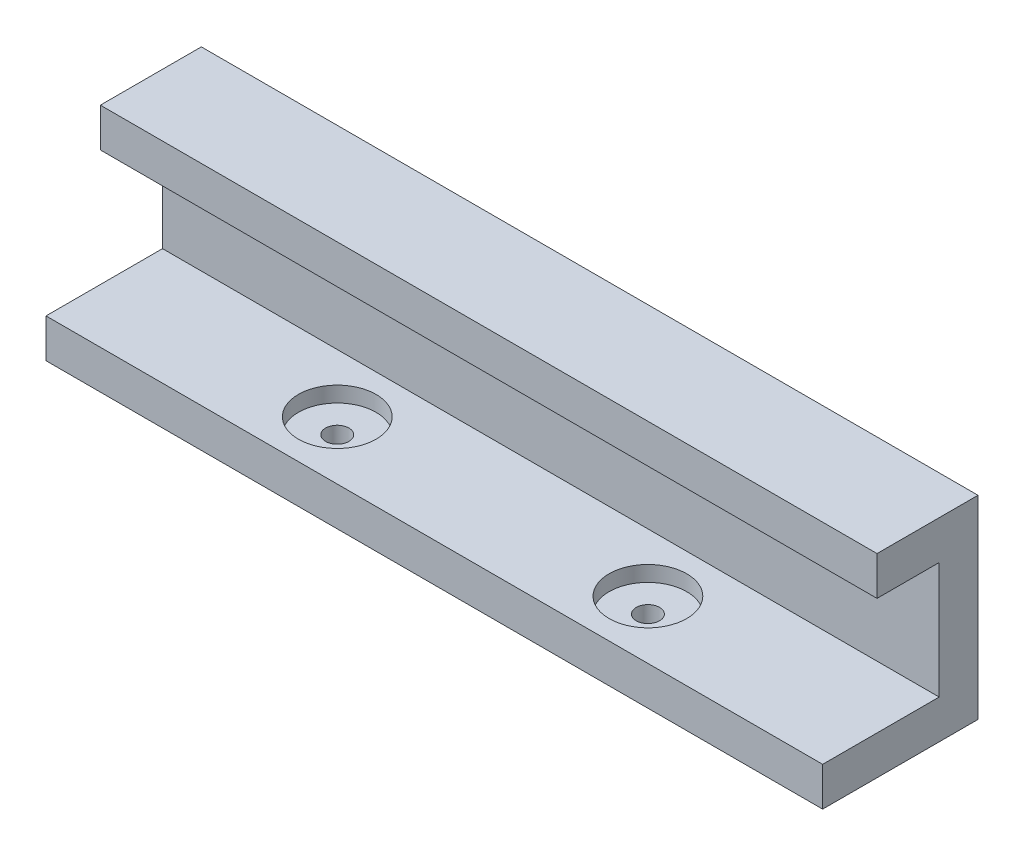
from build123d import *

# Parameters (mm, degrees)
SKETCH1_W           = 100
SKETCH1_H           = 20
SKETCH1_R           = 1.5
BOSS_EXTRUDE1_DEPTH = 5
SKETCH2_W           = 100
SKETCH2_H           = 5
BOSS_EXTRUDE2_DEPTH = 20
SKETCH3_W           = 100
SKETCH3_H           = 5
BOSS_EXTRUDE3_DEPTH = 8
SKETCH4_R           = 5
CUT_EXTRUDE1_DEPTH  = 2


with BuildPart() as part:
    # Sketch1 → Boss-Extrude1 (new body)
    with BuildSketch(Plane(origin=(0, 0, 0), x_dir=(1, 0, 0), z_dir=(0, 1, 0))):
        with Locations((50, 10)):
            Rectangle(SKETCH1_W, SKETCH1_H)
        with Locations((30, 7.5)):
            Circle(SKETCH1_R, mode=Mode.SUBTRACT)
        with Locations((70, 7.5)):
            Circle(SKETCH1_R, mode=Mode.SUBTRACT)
    extrude(amount=BOSS_EXTRUDE1_DEPTH)

    # Sketch2 → Boss-Extrude2 (add)
    with BuildSketch(Plane(origin=(0, 5, 0), x_dir=(1, 0, 0), z_dir=(0, 1, 0))):
        with Locations((50, 17.5)):
            Rectangle(SKETCH2_W, SKETCH2_H)
    extrude(amount=BOSS_EXTRUDE2_DEPTH)

    # Sketch3 → Boss-Extrude3 (add)
    with BuildSketch(Plane.XY.offset(-15)):
        with Locations((50, 22.5)):
            Rectangle(SKETCH3_W, SKETCH3_H)
    extrude(amount=BOSS_EXTRUDE3_DEPTH)

    # Sketch4 → Cut-Extrude1 (cut)
    with BuildSketch(Plane(origin=(0, 5, 0), x_dir=(1, 0, 0), z_dir=(0, 1, 0))):
        with Locations((30, 7.5)):
            Circle(SKETCH4_R)
        with Locations((70, 7.5)):
            Circle(SKETCH4_R)
    extrude(amount=-CUT_EXTRUDE1_DEPTH, mode=Mode.SUBTRACT)


solid = part.part
